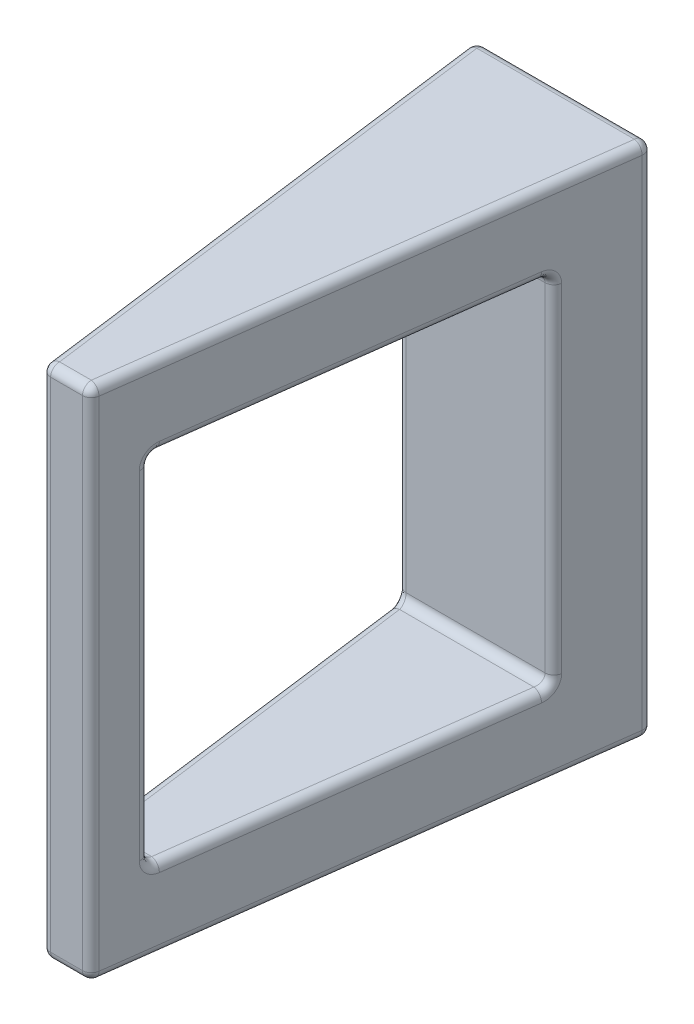
from build123d import *

# Parameters (mm, degrees)
A_FRAME_BODY_DEPTH       = 92.075
A_FRAME_BODY_DEPTH_BACK  = 92.075
WINDOW_CUTOUT_DEPTH      = 203.728163127
WINDOW_CUTOUT_DEPTH_BACK = 203.728163127
WINDOW_SKETCH_W          = 127
WINDOW_SKETCH_H          = 127
MOUNTING_HOLES_SKETCH_R  = 3.96875
MOUNTING_HOLES_DEPTH     = 12.7
EXTERNAL_FILLETS_R       = 3.175


with BuildPart() as part:
    # A-Frame Profile → A-Frame Body (new, two sides: drawn at the far end of the back side and taken through both)
    with BuildSketch(Plane(origin=(0, 0, 0), x_dir=(-1, 0, 0), z_dir=(0, 1, 0)).offset(-A_FRAME_BODY_DEPTH_BACK)):
        Polygon((-31.75, 0), (31.75, 0), (8.466666667, 177.8), (-8.466666667, 177.8), align=None)
    extrude(amount=A_FRAME_BODY_DEPTH + A_FRAME_BODY_DEPTH_BACK)

    # Window Sketch → Window Cutout (cut, two sides: drawn at the far end of the back side and taken through both)
    with BuildSketch(Plane.YZ.offset(-WINDOW_CUTOUT_DEPTH_BACK)):
        with Locations((0, 95.25)):
            Rectangle(WINDOW_SKETCH_W, WINDOW_SKETCH_H)
    extrude(amount=WINDOW_CUTOUT_DEPTH + WINDOW_CUTOUT_DEPTH_BACK, mode=Mode.SUBTRACT)

    # Mounting Holes Sketch → Mounting Holes (cut)
    with BuildSketch(Plane(origin=(0, 0, 0), x_dir=(0, 1, 0), z_dir=(0, 0, 1))):
        with Locations((-31.75, 0)):
            Circle(MOUNTING_HOLES_SKETCH_R)
        with Locations((31.75, 0)):
            Circle(MOUNTING_HOLES_SKETCH_R)
    extrude(amount=MOUNTING_HOLES_DEPTH, mode=Mode.SUBTRACT)

    # External Fillets
    external_fillets_edges = [part.edges().sort_by_distance(p)[0] for p in [
        (0, 27.78125, 12.7),
        (0, 27.78125, 0),
        (0, -35.71875, 0),
        (0, -35.71875, 12.7),
        (0, -63.5, 31.75),
        (0, 63.5, 31.75),
        (0, 63.5, 158.75),
        (0, -63.5, 158.75),
        (27.592261905, 0, 31.75),
        (19.276785714, 63.5, 95.25),
        (10.961309524, 0, 158.75),
        (19.276785714, -63.5, 95.25),
        (20.108333333, 92.075, 88.9),
        (0, 92.075, 0),
        (-20.108333333, 92.075, 88.9),
        (0, 92.075, 177.8),
        (20.108333333, -92.075, 88.9),
        (0, -92.075, 0),
        (-20.108333333, -92.075, 88.9),
        (0, -92.075, 177.8),
        (31.75, 0, 0),
        (-31.75, 0, 0),
        (-8.466666667, 0, 177.8),
        (8.466666667, 0, 177.8),
        (-27.592261905, 0, 31.75),
        (-19.276785714, 63.5, 95.25),
        (-10.961309524, 0, 158.75),
        (-19.276785714, -63.5, 95.25),
    ]]
    fillet(external_fillets_edges, radius=EXTERNAL_FILLETS_R)


solid = part.part
